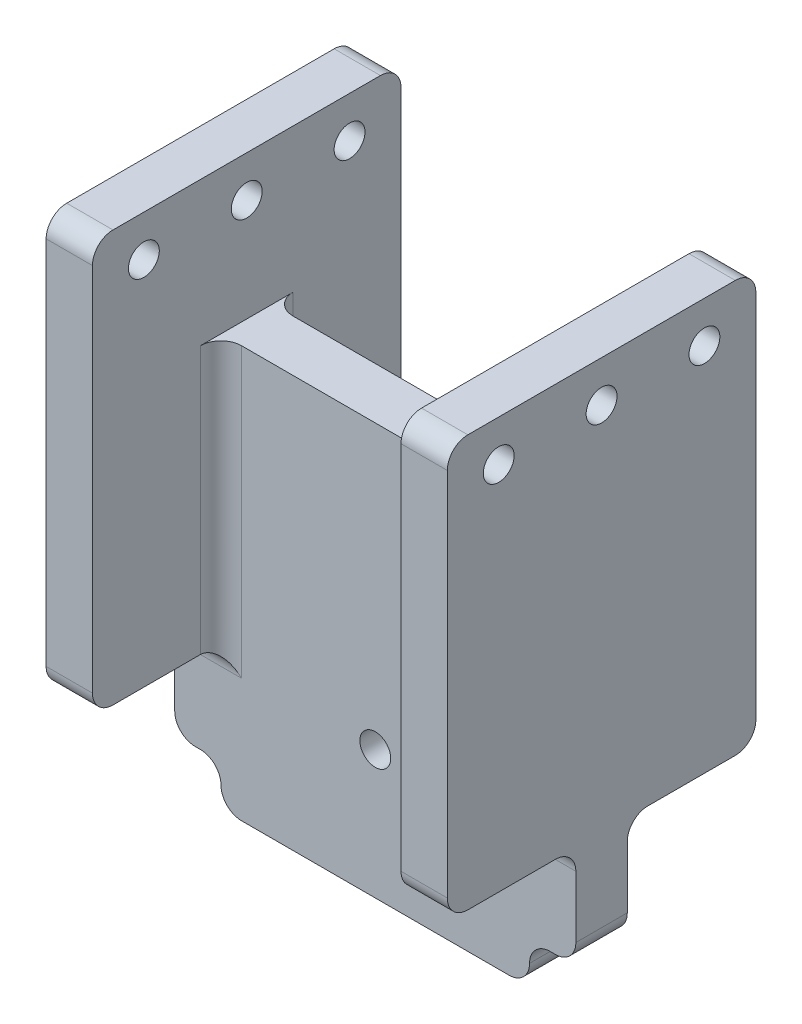
from build123d import *

# Parameters (mm, degrees)
SKETCH_1_W           = 30
SKETCH_1_H           = 50
EXTRUDE_1_DEPTH      = 5
SKETCH_5_W           = 30
SKETCH_5_H           = 50
EXTRUDE_2_DEPTH      = 4.5
SKETCH_6_R           = 1.5
CUT_EXTRUDE_1_DEPTH  = 73.857738093
SKETCH_7_R           = 1.5
CUT_EXTRUDE_2_DEPTH  = 73.857738093
SKETCH_12_W          = 12.5
SKETCH_12_H          = 10
CUT_EXTRUDE_8_DEPTH  = 71.551399703
SKETCH_13_W          = 12.5
SKETCH_13_H          = 10
CUT_EXTRUDE_9_DEPTH  = 71.551399703
SKETCH_16_W          = 30
SKETCH_16_H          = 5
EXTRUDE_3_DEPTH      = 20
SKETCH_17_R          = 1.5
CUT_EXTRUDE_10_DEPTH = 20
SKETCH_18_W          = 53.118549685
SKETCH_18_H          = 48.988218424
CUT_EXTRUDE_11_DEPTH = 20
FILLET_1_R           = 2
FILLET_2_R           = 2
FILLET_3_R           = 2
FILLET_4_R           = 2
SKETCH_19_R          = 1.5
CUT_EXTRUDE_12_DEPTH = 10
SKETCH_21_R          = 1.5
EXTRUDE_4_DEPTH      = 5


with BuildPart() as part:
    # 草图1 → 凸台-拉伸1 (new body)
    with BuildSketch(Plane.XY):
        Rectangle(SKETCH_1_W, SKETCH_1_H)
    extrude(amount=EXTRUDE_1_DEPTH)

    # 草图5 → 凸台-拉伸2 (add)
    with BuildSketch(Plane.ZY.offset(15)):
        with Locations((2.5, 34)):
            Rectangle(SKETCH_5_W, SKETCH_5_H)
    extrude_2 = extrude(amount=EXTRUDE_2_DEPTH)

    # 镜向1: 凸台-拉伸2 across plane
    add(extrude_2.mirror(Plane(origin=(0, 0, 0), x_dir=(0, 0, 1), z_dir=(1, 0, 0))))

    # 草图6 → 切除-拉伸1 (cut, through all)
    with BuildSketch(Plane.ZY.offset(19.5)):
        with Locations((2.5, 55)):
            Circle(SKETCH_6_R)
    extrude(amount=-CUT_EXTRUDE_1_DEPTH, mode=Mode.SUBTRACT)

    # 草图7 → 切除-拉伸2 (cut, through all)
    with BuildSketch(Plane.ZY.offset(19.5)):
        with Locations((-7.5, 55)):
            Circle(SKETCH_7_R)
        with Locations((12.5, 55)):
            Circle(SKETCH_7_R)
    extrude(amount=-CUT_EXTRUDE_2_DEPTH, mode=Mode.SUBTRACT)

    # 草图12 → 切除-拉伸8 (cut, through all)
    with BuildSketch(Plane(origin=(-15, 0, 0), x_dir=(0, 0, -1), z_dir=(1, 0, 0))):
        with Locations((6.25, 14)):
            Rectangle(SKETCH_12_W, SKETCH_12_H)
        with Locations((-11.25, 14)):
            Rectangle(SKETCH_12_W, SKETCH_12_H)
    extrude(amount=-CUT_EXTRUDE_8_DEPTH, mode=Mode.SUBTRACT)

    # 草图13 → 切除-拉伸9 (cut, through all)
    with BuildSketch(Plane.ZY.offset(-15)):
        with Locations((11.25, 14)):
            Rectangle(SKETCH_13_W, SKETCH_13_H)
        with Locations((-6.25, 14)):
            Rectangle(SKETCH_13_W, SKETCH_13_H)
    extrude(amount=-CUT_EXTRUDE_9_DEPTH, mode=Mode.SUBTRACT)

    # 草图16 → 凸台-拉伸3 (add)
    with BuildSketch(Plane(origin=(0, 25, 0), x_dir=(1, 0, 0), z_dir=(0, 1, 0))):
        with Locations((0, -2.5)):
            Rectangle(SKETCH_16_W, SKETCH_16_H)
    extrude(amount=EXTRUDE_3_DEPTH)

    # 草图17 → 切除-拉伸10 (cut)
    with BuildSketch(Plane.XY.offset(5)):
        with Locations((0, 12.5)):
            Circle(SKETCH_17_R)
    extrude(amount=-CUT_EXTRUDE_10_DEPTH, mode=Mode.SUBTRACT)

    # 草图18 → 切除-拉伸11 (cut)
    with BuildSketch(Plane.XY.offset(5)):
        with Locations((5.810767558, -19.494109212)):
            Rectangle(SKETCH_18_W, SKETCH_18_H)
    extrude(amount=-CUT_EXTRUDE_11_DEPTH, mode=Mode.SUBTRACT)

    # 圆角1
    fillet_1_edges = [part.edges().sort_by_distance(p)[0] for p in [
        (17.25, 19, 5),
        (17.25, 19, 0),
        (-17.25, 19, 0),
        (-17.25, 19, 5),
    ]]
    fillet(fillet_1_edges, radius=FILLET_1_R)

    # 圆角2
    fillet_2_edges = [part.edges().sort_by_distance(p)[0] for p in [
        (15, 31, 0),
        (-15, 31, 0),
        (15, 31, 5),
        (-15, 31, 5),
    ]]
    fillet(fillet_2_edges, radius=FILLET_2_R)

    # 圆角3
    fillet_3_edges = [part.edges().sort_by_distance(p)[0] for p in [
        (17.25, 19, 17.5),
        (17.25, 19, -12.5),
        (-17.25, 59, -12.5),
        (-17.25, 59, 17.5),
        (17.25, 59, -12.5),
        (17.25, 59, 17.5),
        (-17.25, 19, -12.5),
        (-17.25, 19, 17.5),
    ]]
    fillet(fillet_3_edges, radius=FILLET_3_R)

    # 圆角4
    fillet_4_edges = [part.edges().sort_by_distance(p)[0] for p in [
        (15, 9, 2.5),
        (-15, 9, 2.5),
        (19.5, 9, 2.5),
        (15, 5, 2.5),
        (-15, 5, 2.5),
        (-19.5, 9, 2.5),
    ]]
    fillet(fillet_4_edges, radius=FILLET_4_R - 0.0001)  # a hair under: the kernel refuses the full size

    # 草图19 → 切除-拉伸12 (cut)
    with BuildSketch(Plane.XY.offset(5)):
        with Locations((0, 17.5)):
            Circle(SKETCH_19_R)
    extrude(amount=-CUT_EXTRUDE_12_DEPTH, mode=Mode.SUBTRACT)

    # 草图21 → 凸台-拉伸4 (add)
    with BuildSketch(Plane.XY.offset(5)):
        with Locations((0, 12.5)):
            Circle(SKETCH_21_R)
    extrude(amount=-EXTRUDE_4_DEPTH)


solid = part.part
